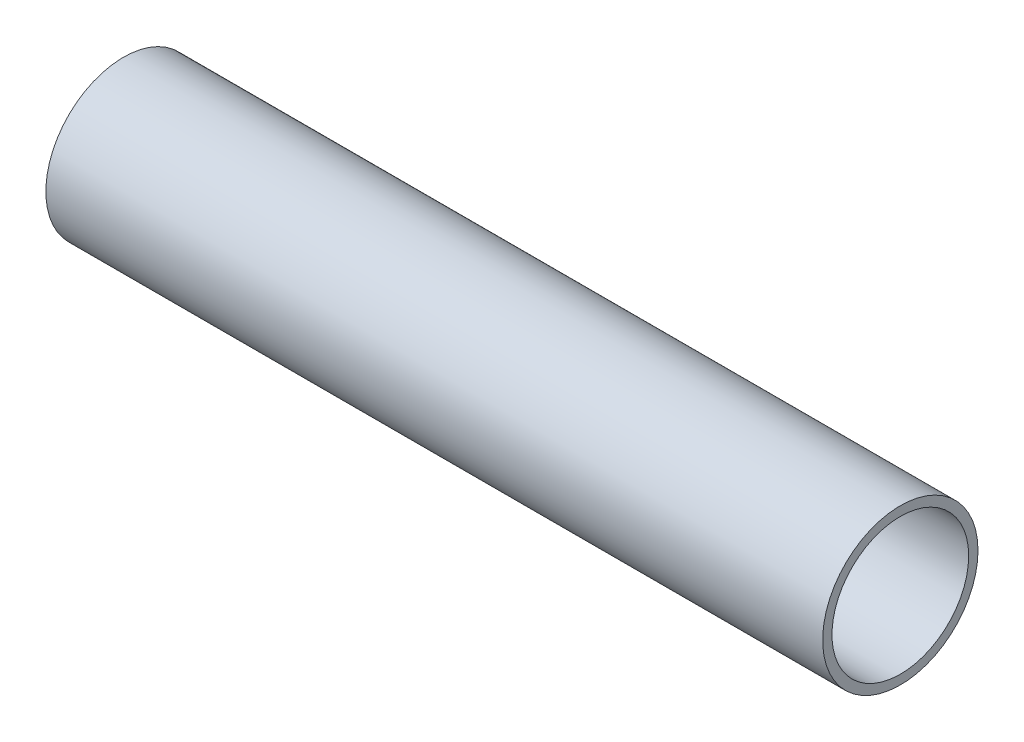
from build123d import *

# Parameters (mm, degrees)
SKETCH_1_R      = 25
SKETCH_1_R_2    = 22
EXTRUDE_1_DEPTH = 250


with BuildPart() as part:
    # Эскиз1 → Бобышка-Вытянуть1 (new body)
    with BuildSketch(Plane(origin=(0, 0, 0), x_dir=(0, 0, -1), z_dir=(1, 0, 0))):
        Circle(SKETCH_1_R)
        Circle(SKETCH_1_R_2, mode=Mode.SUBTRACT)
    extrude(amount=EXTRUDE_1_DEPTH)


solid = part.part
